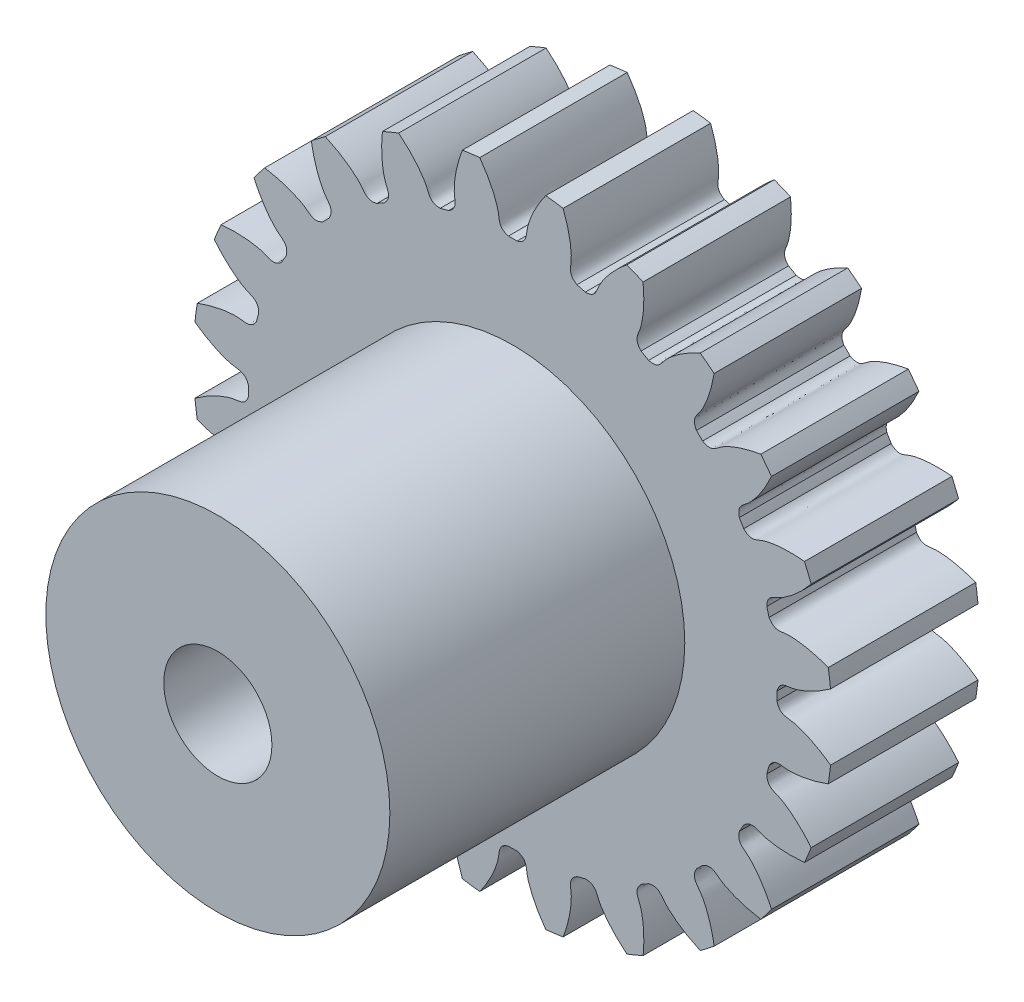
from build123d import *

# Parameters (mm, degrees)
SKETCH_1_R               = 6.5
EXTRUDE_1_DEPTH          = 3
CUT_EXTRUDE_1_DEPTH      = 10.669539803
PATTERN_CIRCULAR_1_COUNT = 24
SKETCH_5_R               = 3.5
EXTRUDE_2_DEPTH          = 6
CUT_EXTRUDE_2_REACH      = 15.936
CUT_EXTRUDE_START        = -3
SKETCH_4_R               = 1.1


with BuildPart() as part:
    # 草图1 → 凸台-拉伸1 (new body)
    with BuildSketch(Plane.XY):
        Circle(SKETCH_1_R)
    extrude(amount=EXTRUDE_1_DEPTH)

    # 草图2 → 切除-拉伸1 (cut, through all)
    with BuildSketch(Plane.XY):
        with BuildLine():
            ThreePointArc((0.088415956, 5.374272753), (0, 5.375), (-0.088415956, 5.374272753))
            add(Edge.make_bspline(
                [(-0.088415956, 5.374272753), (-0.283956108, 5.428430036), (-0.269523883, 5.557861799), (-0.293138588, 5.686342226), (-0.296517959, 5.702916521), (-0.300724242, 5.721620073), (-0.305840304, 5.742426358), (-0.311952817, 5.765305336), (-0.319146149, 5.790224685), (-0.327504211, 5.817149434), (-0.337109789, 5.846042111), (-0.348044663, 5.876862729), (-0.360389484, 5.909568827), (-0.374223721, 5.944115495), (-0.389625595, 5.980455405), (-0.406672011, 6.018538843), (-0.425438499, 6.058313744), (-0.445999145, 6.099725726), (-0.468426535, 6.142718129), (-0.492791687, 6.187232054), (-0.519163995, 6.233206399), (-0.547611171, 6.280577906), (-0.57819918, 6.329281201), (-0.610992189, 6.379248841), (-0.64605251, 6.430411359), (-0.68344054, 6.482697309), (-0.723214712, 6.53603332), (-0.765431443, 6.590344144), (-0.810145078, 6.645552705), (-0.857407842, 6.701580158), (-0.907269792, 6.758345935), (-0.959778768, 6.81576781), (-1.014980347, 6.873761948), (-1.0729178, 6.932242967), (-1.133632047, 6.991123994), (-1.197161611, 7.05031673), (-1.263542589, 7.109731505), (-1.332808587, 7.169277345), (-1.430211047, 7.249680778), (-1.505961903, 7.308439159), (-1.55780976, 7.347058965)],
                knots=[0, 0, 0, 0, 0.143961355, 0.149818462, 0.156576662, 0.164235955, 0.172796342, 0.182257821, 0.192620395, 0.203884061, 0.216048821, 0.229114674, 0.24308162, 0.25794966, 0.273718793, 0.290389019, 0.307960339, 0.326432751, 0.345806258, 0.366080857, 0.38725655, 0.409333336, 0.432311215, 0.456190188, 0.480970254, 0.506651413, 0.533233666, 0.560717012, 0.589101451, 0.618386984, 0.64857361, 0.679661329, 0.711650141, 0.744540047, 0.778331046, 0.813023138, 0.848616324, 0.885110603, 0.922505975, 1, 1, 1, 1], degree=3))
            ThreePointArc((-1.55780976, 7.347058965), (0, 7.510395907), (1.55780976, 7.347058965))
            add(Edge.make_bspline(
                [(0.088415956, 5.374272753), (0.283956108, 5.428430036), (0.269523883, 5.557861799), (0.293138588, 5.686342226), (0.296517959, 5.702916521), (0.300724242, 5.721620073), (0.305840304, 5.742426358), (0.311952817, 5.765305336), (0.319146149, 5.790224685), (0.327504211, 5.817149434), (0.337109789, 5.846042111), (0.348044663, 5.876862729), (0.360389484, 5.909568827), (0.374223721, 5.944115495), (0.389625595, 5.980455405), (0.406672011, 6.018538843), (0.425438499, 6.058313744), (0.445999145, 6.099725726), (0.468426535, 6.142718129), (0.492791687, 6.187232054), (0.519163995, 6.233206399), (0.547611171, 6.280577906), (0.57819918, 6.329281201), (0.610992189, 6.379248841), (0.64605251, 6.430411359), (0.68344054, 6.482697309), (0.723214712, 6.53603332), (0.765431443, 6.590344144), (0.810145078, 6.645552705), (0.857407842, 6.701580158), (0.907269792, 6.758345935), (0.959778768, 6.81576781), (1.014980347, 6.873761948), (1.0729178, 6.932242967), (1.133632047, 6.991123994), (1.197161611, 7.05031673), (1.263542589, 7.109731505), (1.332808587, 7.169277345), (1.430211047, 7.249680778), (1.505961903, 7.308439159), (1.55780976, 7.347058965)],
                knots=[0, 0, 0, 0, 0.143961355, 0.149818462, 0.156576662, 0.164235955, 0.172796342, 0.182257821, 0.192620395, 0.203884061, 0.216048821, 0.229114674, 0.24308162, 0.25794966, 0.273718793, 0.290389019, 0.307960339, 0.326432751, 0.345806258, 0.366080857, 0.38725655, 0.409333336, 0.432311215, 0.456190188, 0.480970254, 0.506651413, 0.533233666, 0.560717012, 0.589101451, 0.618386984, 0.64857361, 0.679661329, 0.711650141, 0.744540047, 0.778331046, 0.813023138, 0.848616324, 0.885110603, 0.922505975, 1, 1, 1, 1], degree=3))
        make_face()
    cut_extrude_1 = extrude(amount=CUT_EXTRUDE_1_DEPTH, mode=Mode.SUBTRACT)

    # 阵列(圆周)1: 切除-拉伸1 ×24 about axis
    pattern_circular_1_axis = Axis((0, 0, 3), (0, 0, -1))
    for i in range(1, PATTERN_CIRCULAR_1_COUNT):
        add(cut_extrude_1.rotate(pattern_circular_1_axis, i * 360 / PATTERN_CIRCULAR_1_COUNT), mode=Mode.SUBTRACT)

    # 草图5 → 凸台-拉伸2 (add)
    with BuildSketch(Plane.XY.offset(3)):
        Circle(SKETCH_5_R)
    extrude(amount=EXTRUDE_2_DEPTH)

    # 草图4 → 切除-拉伸2 (cut, up to next)
    with BuildSketch(Plane.XY.offset(3).offset(CUT_EXTRUDE_START), mode=Mode.PRIVATE) as cut_extrude_2_sk1:
        Circle(SKETCH_4_R)
    cut_extrude_2_tool1 = extrude(cut_extrude_2_sk1.sketch, amount=CUT_EXTRUDE_2_REACH, mode=Mode.PRIVATE) & part.part
    add(cut_extrude_2_tool1.solids().sort_by_distance((0, 0, 0))[0], mode=Mode.SUBTRACT)


solid = part.part
